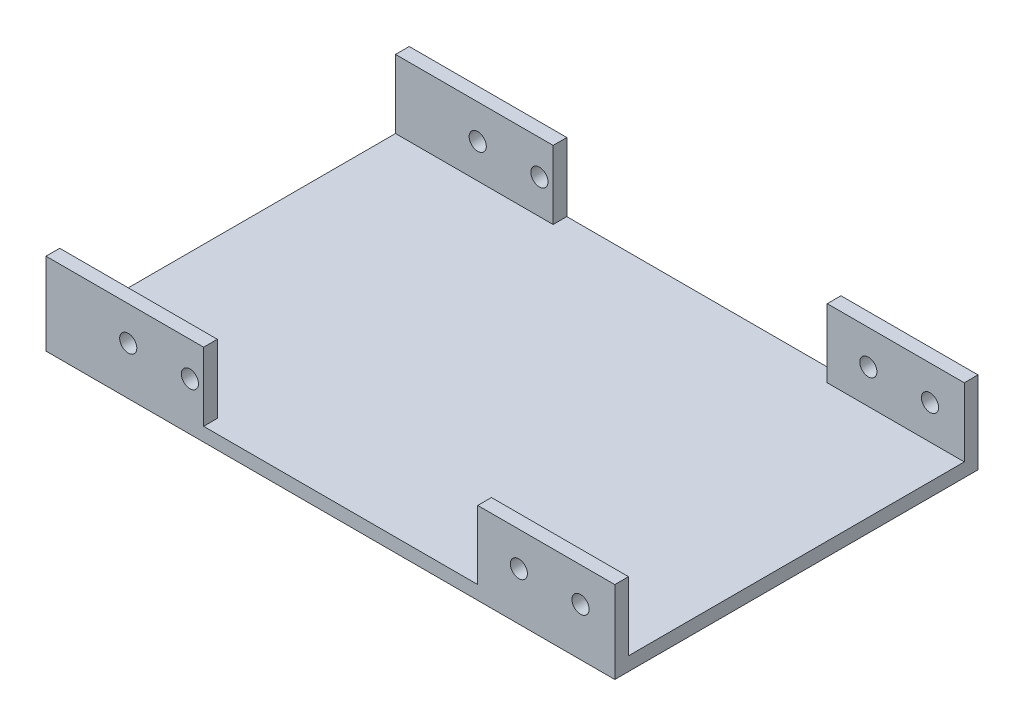
from build123d import *

# Parameters (mm, degrees)
SKETCH1_W           = 83
SKETCH1_H           = 53
BOSS_EXTRUDE1_DEPTH = 2
SKETCH2_W           = 20
SKETCH2_H           = 2
SKETCH2_W_2         = 23
BOSS_EXTRUDE2_DEPTH = 10
SKETCH3_R           = 1.25
CUT_EXTRUDE1_DEPTH  = 83.442829454


with BuildPart() as part:
    # Sketch1 → Boss-Extrude1 (new body)
    with BuildSketch(Plane(origin=(0, 0, 0), x_dir=(1, 0, 0), z_dir=(0, 1, 0))):
        with Locations((-20.498549405, 1.194031796)):
            Rectangle(SKETCH1_W, SKETCH1_H)
    extrude(amount=BOSS_EXTRUDE1_DEPTH)

    # Sketch2 → Boss-Extrude2 (add)
    with BuildSketch(Plane(origin=(0, 2, 0), x_dir=(1, 0, 0), z_dir=(0, 1, 0))):
        with Locations((11.001450595, 26.694031796)):
            Rectangle(SKETCH2_W, SKETCH2_H)
        with Locations((11.001450595, -24.305968204)):
            Rectangle(SKETCH2_W, SKETCH2_H)
        with Locations((-50.498549405, 26.694031796)):
            Rectangle(SKETCH2_W_2, SKETCH2_H)
        with Locations((-50.498549405, -24.305968204)):
            Rectangle(SKETCH2_W_2, SKETCH2_H)
    extrude(amount=BOSS_EXTRUDE2_DEPTH)

    # Sketch3 → Cut-Extrude1 (cut, through all)
    with BuildSketch(Plane.XY.offset(25.305968204)):
        with Locations((16.001450595, 7)):
            Circle(SKETCH3_R)
        with Locations((7.001450595, 7)):
            Circle(SKETCH3_R)
        with Locations((-40.998549405, 7)):
            Circle(SKETCH3_R)
        with Locations((-49.998549405, 7)):
            Circle(SKETCH3_R)
    extrude(amount=-CUT_EXTRUDE1_DEPTH, mode=Mode.SUBTRACT)


solid = part.part
